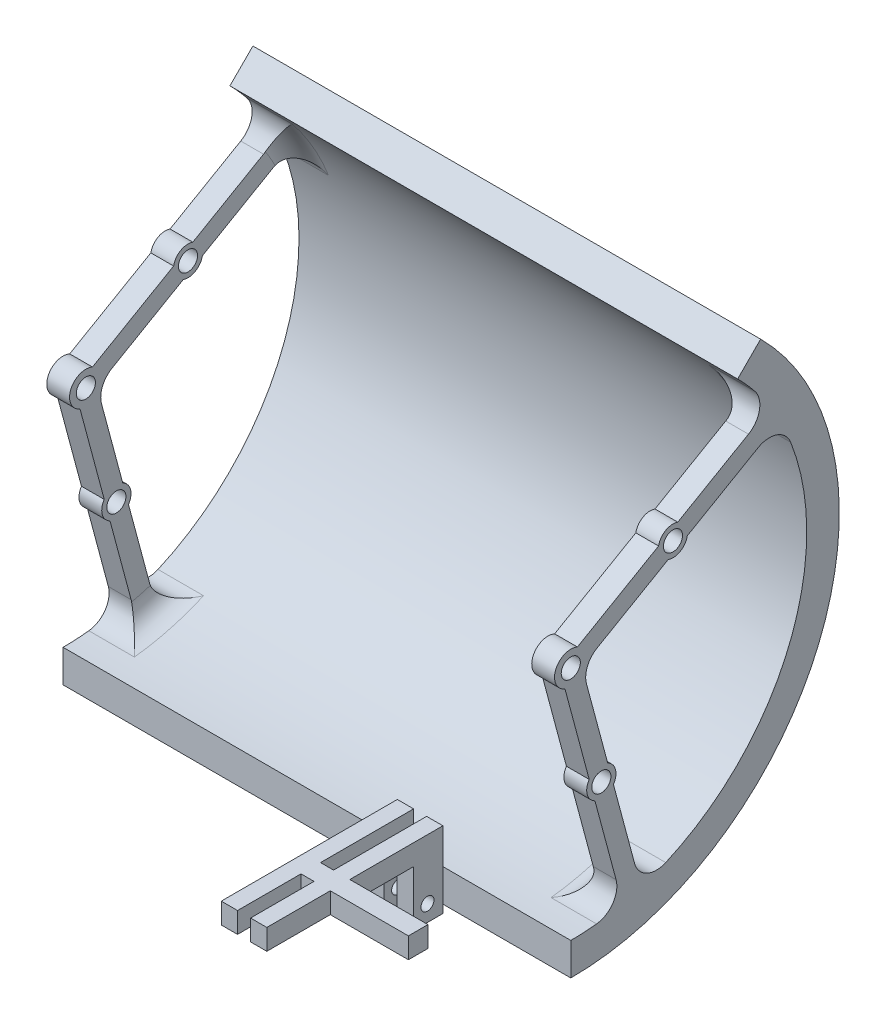
from build123d import *

# Parameters (mm, degrees)
SKETCH1_W                = 78.006
SKETCH1_H                = 5
REVOLVE1_ANGLE           = 135
BOSS_EXTRUDE1_DEPTH      = 3.5
SKETCH5_R                = 1.47
CUT_EXTRUDE1_DEPTH       = 111.505307794
FILLET1_R                = 3.5
FILLET2_R                = 3.5
SKETCH6_W                = 2.5
SKETCH6_H                = 11.68
BOSS_EXTRUDE2_DEPTH      = 4.55
SKETCH11_W               = 6.879892748
SKETCH11_H               = 4
BOSS_EXTRUDE4_DEPTH      = 79.29
SKETCH13_W               = 9.54
SKETCH13_H               = 3.842548585
BOSS_EXTRUDE5_DEPTH      = 7.5
FILLET4_R                = 4
SKETCH17_W               = 3.18
SKETCH17_H               = 7.5
CUT_EXTRUDE12_DEPTH      = 3.842548586
CUT_EXTRUDE13_REACH      = 101.676
SKETCH18_R               = 1.47
BOSS_EXTRUDE6_DEPTH      = 3.18
SKETCH21_W               = 1.284
SKETCH21_H               = 6.879892748
CUT_EXTRUDE14_DEPTH      = 108.471876866
CUT_EXTRUDE15_START      = -22.063
CUT_EXTRUDE15_DEPTH      = 22.063
CUT_EXTRUDE16_DEPTH      = 14.553
CUT_EXTRUDE17_DEPTH      = 98.779076297
CUT_EXTRUDE17_DEPTH_BACK = 98.779076297
SKETCH25_R               = 1


with BuildPart() as part:
    # Sketch1 → Revolve1 (revolve)
    with BuildSketch(Plane.XY):
        with Locations((39.003, 2.5)):
            Rectangle(SKETCH1_W, SKETCH1_H)
    revolve(axis=Axis((0, 41.25, 0), (1, 0, 0)), revolution_arc=REVOLVE1_ANGLE)

    # Sketch3 → Boss-Extrude1 (add)
    with BuildSketch(Plane(origin=(0, 0, 0), x_dir=(0, 0, -1), z_dir=(1, 0, 0))):
        with BuildLine():
            Line((7.954562011, 5.883526565), (3.71205875, 21.716764286))
            ThreePointArc((3.71205875, 21.716764286), (2.517762083, 23.160251547), (2.830309706, 25.007496518))
            Line((2.830309706, 25.007496518), (-0.896539432, 38.916286854))
            ThreePointArc((-0.896539432, 38.916286854), (-2.309698831, 42.206708581), (1.016235278, 43.534133503))
            Line((1.016235278, 43.534133503), (13.486515541, 50.73385317))
            ThreePointArc((13.486515541, 50.73385317), (14.571710444, 52.261057159), (16.436905346, 52.437261518))
            Line((16.436905346, 52.437261518), (30.632597932, 60.633148453))
            ThreePointArc((30.632597932, 60.633148453), (31.393420887, 59.375), (32.102597932, 58.087033766))
            Line((32.102597932, 58.087033766), (17.906905346, 49.89114683))
            ThreePointArc((17.906905346, 49.89114683), (16.821710444, 48.363942841), (14.956515541, 48.187738482))
            Line((14.956515541, 48.187738482), (1.711851257, 40.540927993))
            Line((1.711851257, 40.540927993), (5.670131635, 25.768424511))
            ThreePointArc((5.670131635, 25.768424511), (6.864428302, 24.32493725), (6.551880679, 22.477692279))
            Line((6.551880679, 22.477692279), (10.79438394, 6.644454558))
            ThreePointArc((10.79438394, 6.644454558), (9.382190385, 6.235188797), (7.954562011, 5.883526565))
        make_face()
    boss_extrude1 = extrude(amount=BOSS_EXTRUDE1_DEPTH)

    # Sketch5 → Cut-Extrude1 (cut, through all)
    with BuildSketch(Plane(origin=(3.5, 0, 0), x_dir=(0, 0, -1), z_dir=(1, 0, 0))):
        with Locations(Location((0, 41.25, 0), (0, 0, 90))):
            Circle(SKETCH5_R)
        with Locations(Location((4.691095192, 23.742594399, 0), (0, 0, 90))):
            Circle(SKETCH5_R)
        with Locations(Location((15.696710444, 50.3125, 0), (0, 0, 90))):
            Circle(SKETCH5_R)
    cut_extrude1 = extrude(amount=-CUT_EXTRUDE1_DEPTH, mode=Mode.SUBTRACT)

    # Mirror1: Boss-Extrude1 across plane
    add(boss_extrude1.mirror(Plane(origin=(39.003, 0, 0), x_dir=(0, 0, 1), z_dir=(1, 0, 0))))

    # Fillet1
    # the kernel refuses this fillet: 3.5 mm, written as the material it adds along each edge
    with BuildSketch(Plane(origin=(0, 5.883526565, -7.954562011), x_dir=(0, -0.16459342427635773, 0.9863614979737311), z_dir=(1, 0, 0)), Plane(origin=(0, 58.087033766, -32.102597932), x_dir=(1.0095903827657901e-15, -0.9101521320486264, -0.4142741803773673), z_dir=(1, 0, 0)), Plane(origin=(78.006, 6.644454558, -10.79438394), x_dir=(0, 0.35063866226765017, -0.9365108266983103), z_dir=(-1, 0, 0)), Plane(origin=(78.006, 60.633148453, -30.632597932), x_dir=(0, 0.8138480303630977, 0.5810777774739851), z_dir=(-1, 0, 0))) as fillet1_piece_1:
        with BuildLine():
            CenterArc((3.8544537, -3.494534817), FILLET1_R, 86.797696391, 98.728687129)
            Line((0.370721847, -3.831599173), (0, 0))
            ThreePointArc((0, 0), (2.024984733, 0.056603685), (4.049969467, 0))
        make_face()
    extrude(amount=3.5)
    with BuildSketch(Plane(origin=(0, 6.644454558, -10.79438394), x_dir=(0, 0.35063866226765, -0.9365108266983104), z_dir=(1, 0, 0)), Plane(origin=(0, 60.633148453, -30.632597932), x_dir=(0, 0.8138480303630977, 0.5810777774739851), z_dir=(1, 0, 0)), Plane(origin=(78.006, 5.883526565, -7.954562011), x_dir=(0, -0.16459342427635773, 0.9863614979737311), z_dir=(-1, 0, 0)), Plane(origin=(78.006, 58.087033766, -32.102597932), x_dir=(-1.0095903827657901e-15, -0.9101521320486264, -0.4142741803773673), z_dir=(-1, 0, 0))) as fillet1_piece_2:
        with BuildLine():
            CenterArc((3.8544537, 3.494534817), FILLET1_R, 174.47361648, 98.728687129)
            Line((0.370721847, 3.831599173), (0, 0))
            ThreePointArc((0, 0), (2.024984733, -0.056603685), (4.049969467, 0))
        make_face()
    extrude(amount=3.5)
    with BuildSketch(Plane(origin=(3.5, 41.25, 0), x_dir=(0, -0.8557788857122749, -0.517341762057788), z_dir=(0, 0.517341762057788, -0.8557788857122749))) as fillet1_piece_3_section:
        with BuildLine():
            CenterArc((36.25 - FILLET1_R, -FILLET1_R), FILLET1_R, 0, 90)
            Line((36.25 - FILLET1_R, 0), (36.25, 0))
            Line((36.25, 0), (36.25, -FILLET1_R))
        make_face()
    fillet1_piece_3 = revolve(axis=Axis((3.5, 41.25, 0), (-1, 0, 0)), revolution_arc=32.308220941, mode=Mode.PRIVATE)
    fillet1_piece_3 = split(fillet1_piece_3, bisect_by=Plane(origin=(3.5, 40.869536004, 1.419910965), z_dir=(0, 0.2588190451025147, -0.9659258262890699)), keep=Keep.TOP, mode=Mode.PRIVATE)
    fillet1_piece_3 = split(fillet1_piece_3, bisect_by=Plane(origin=(3.5, 41.630463996, -1.419910965), z_dir=(0, -0.2588190451025142, 0.9659258262890701)), keep=Keep.TOP, mode=Mode.PRIVATE)
    add(fillet1_piece_3)
    with BuildSketch(Plane(origin=(3.5, 41.25, 0), x_dir=(0, 0.7212056430084437, -0.6927210264549339), z_dir=(0, 0.6927210264549339, 0.7212056430084437))) as fillet1_piece_4_section:
        with BuildLine():
            CenterArc((36.25 - FILLET1_R, -FILLET1_R), FILLET1_R, 360, 90)
            Line((36.25 - FILLET1_R, 0), (36.25, 0))
            Line((36.25, 0), (36.25, -FILLET1_R))
        make_face()
    fillet1_piece_4 = revolve(axis=Axis((3.5, 41.25, 0), (-1, 0, 0)), revolution_arc=32.308220941, mode=Mode.PRIVATE)
    fillet1_piece_4 = split(fillet1_piece_4, bisect_by=Plane(origin=(3.5, 42.523057344, 0.735), z_dir=(0, -0.8660254037844376, -0.5000000000000018)), keep=Keep.TOP, mode=Mode.PRIVATE)
    fillet1_piece_4 = split(fillet1_piece_4, bisect_by=Plane(origin=(3.5, 39.976942656, -0.735), z_dir=(0, 0.8660254037844395, 0.4999999999999985)), keep=Keep.TOP, mode=Mode.PRIVATE)
    add(fillet1_piece_4)
    with BuildSketch(Plane(origin=(74.506, 41.25, 0), x_dir=(-1.1760707350509122e-15, -0.8557788857122749, -0.517341762057788), z_dir=(0, 0.517341762057788, -0.8557788857122749))) as fillet1_piece_5_section:
        with BuildLine():
            CenterArc((36.25 - FILLET1_R, FILLET1_R), FILLET1_R, 270, 90)
            Line((36.25 - FILLET1_R, 0), (36.25, 0))
            Line((36.25, 0), (36.25, FILLET1_R))
        make_face()
    fillet1_piece_5 = revolve(axis=Axis((74.506, 41.25, 0), (-1, 0, 0)), revolution_arc=32.308220941, mode=Mode.PRIVATE)
    fillet1_piece_5 = split(fillet1_piece_5, bisect_by=Plane(origin=(74.506, 40.869536004, 1.419910965), z_dir=(0, 0.2588190451025147, -0.9659258262890699)), keep=Keep.TOP, mode=Mode.PRIVATE)
    fillet1_piece_5 = split(fillet1_piece_5, bisect_by=Plane(origin=(74.506, 41.630463996, -1.419910965), z_dir=(0, -0.2588190451025142, 0.9659258262890701)), keep=Keep.TOP, mode=Mode.PRIVATE)
    add(fillet1_piece_5)
    with BuildSketch(Plane(origin=(74.506, 41.25, 0), x_dir=(0, 0.7212056430084435, -0.6927210264549343), z_dir=(0, 0.6927210264549343, 0.7212056430084435))) as fillet1_piece_6_section:
        with BuildLine():
            CenterArc((36.25 - FILLET1_R, FILLET1_R), FILLET1_R, 270, 90)
            Line((36.25 - FILLET1_R, 0), (36.25, 0))
            Line((36.25, 0), (36.25, FILLET1_R))
        make_face()
    fillet1_piece_6 = revolve(axis=Axis((74.506, 41.25, 0), (-1, 0, 0)), revolution_arc=32.308220941, mode=Mode.PRIVATE)
    fillet1_piece_6 = split(fillet1_piece_6, bisect_by=Plane(origin=(74.506, 42.523057344, 0.735), z_dir=(0, -0.8660254037844376, -0.5000000000000018)), keep=Keep.TOP, mode=Mode.PRIVATE)
    fillet1_piece_6 = split(fillet1_piece_6, bisect_by=Plane(origin=(74.506, 39.976942656, -0.735), z_dir=(0, 0.8660254037844395, 0.4999999999999985)), keep=Keep.TOP, mode=Mode.PRIVATE)
    add(fillet1_piece_6)
    with BuildSketch(Plane(origin=(0, 5.883526565, -7.954562011), x_dir=(0, -0.16459342427635773, 0.9863614979737311), z_dir=(1, 0, 0))) as fillet1_piece_7a_section:
        with BuildLine():
            CenterArc((3.8544537, -3.494534817), FILLET1_R, 86.797696391, 98.728687129)
            Line((0.370721847, -3.831599173), (0, 0))
            ThreePointArc((0, 0), (2.024984733, 0.056603685), (4.049969467, 0))
        make_face()
    fillet1_piece_7a = extrude(amount=13.624923667, mode=Mode.PRIVATE)
    fillet1_piece_7a = split(fillet1_piece_7a, bisect_by=Plane(origin=(3.5, 5.883526565, -7.954562011), z_dir=(1, 0, 0)), keep=Keep.TOP, mode=Mode.PRIVATE)
    with BuildSketch(Plane(origin=(3.5, 41.25, 0), x_dir=(0, -0.8557788857122749, -0.517341762057788), z_dir=(0, 0.517341762057788, -0.8557788857122749))) as fillet1_piece_7b_section:
        with BuildLine():
            CenterArc((36.25 - FILLET1_R, -FILLET1_R), FILLET1_R, 0, 90)
            Line((36.25 - FILLET1_R, 0), (36.25, 0))
            Line((36.25, 0), (36.25, -FILLET1_R))
        make_face()
    fillet1_piece_7b = revolve(axis=Axis((3.5, 41.25, 0), (-1, 0, 0)), revolution_arc=32.308220941, mode=Mode.PRIVATE)
    fillet1_piece_7b = split(fillet1_piece_7b, bisect_by=Plane(origin=(3.5, 41.25, 0), z_dir=(0, 0, -1)), keep=Keep.TOP, mode=Mode.PRIVATE)
    fillet1_piece_7b = split(fillet1_piece_7b, bisect_by=Plane(origin=(3.5, 40.869536004, 1.419910965), z_dir=(0, -0.2588190451025147, 0.9659258262890699)), keep=Keep.TOP, mode=Mode.PRIVATE)
    fillet1_piece_7 = fillet1_piece_7a & fillet1_piece_7b
    add(fillet1_piece_7)
    with BuildSketch(Plane(origin=(3.5, 41.25, 0), x_dir=(0, -0.8557788857122749, -0.517341762057788), z_dir=(0, 0.517341762057788, -0.8557788857122749))) as fillet1_piece_8a_section:
        with BuildLine():
            CenterArc((36.25 - FILLET1_R, -FILLET1_R), FILLET1_R, 0, 90)
            Line((36.25 - FILLET1_R, 0), (36.25, 0))
            Line((36.25, 0), (36.25, -FILLET1_R))
        make_face()
    fillet1_piece_8a = revolve(axis=Axis((3.5, 41.25, 0), (-1, 0, 0)), revolution_arc=32.308220941, mode=Mode.PRIVATE)
    fillet1_piece_8a = split(fillet1_piece_8a, bisect_by=Plane(origin=(3.5, 41.630463996, -1.419910965), z_dir=(0, 0.2588190451025142, -0.9659258262890701)), keep=Keep.TOP, mode=Mode.PRIVATE)
    with BuildSketch(Plane(origin=(0, 6.644454558, -10.79438394), x_dir=(0, 0.35063866226765, -0.9365108266983104), z_dir=(1, 0, 0))) as fillet1_piece_8b_section:
        with BuildLine():
            CenterArc((3.8544537, 3.494534817), FILLET1_R, 174.47361648, 98.728687129)
            Line((0.370721847, 3.831599173), (0, 0))
            ThreePointArc((0, 0), (2.024984733, -0.056603685), (4.049969467, 0))
        make_face()
    fillet1_piece_8b = extrude(amount=13.624923667, mode=Mode.PRIVATE)
    fillet1_piece_8b = split(fillet1_piece_8b, bisect_by=Plane(origin=(3.5, 6.644454558, -10.79438394), z_dir=(1, 0, 0)), keep=Keep.TOP, mode=Mode.PRIVATE)
    fillet1_piece_8 = fillet1_piece_8a & fillet1_piece_8b
    add(fillet1_piece_8)
    with BuildSketch(Plane(origin=(0, 58.087033766, -32.102597932), x_dir=(1.0095903827657901e-15, -0.9101521320486264, -0.4142741803773673), z_dir=(1, 0, 0))) as fillet1_piece_9a_section:
        with BuildLine():
            CenterArc((3.8544537, -3.494534817), FILLET1_R, 86.797696391, 98.728687129)
            Line((0.370721847, -3.831599173), (0, 0))
            ThreePointArc((0, 0), (2.024984733, 0.056603685), (4.049969467, 0))
        make_face()
    fillet1_piece_9a = extrude(amount=13.624923667, mode=Mode.PRIVATE)
    fillet1_piece_9a = split(fillet1_piece_9a, bisect_by=Plane(origin=(3.5, 58.087033766, -32.102597932), z_dir=(1, 0, 0)), keep=Keep.TOP, mode=Mode.PRIVATE)
    with BuildSketch(Plane(origin=(3.5, 41.25, 0), x_dir=(0, 0.7212056430084437, -0.6927210264549339), z_dir=(0, 0.6927210264549339, 0.7212056430084437))) as fillet1_piece_9b_section:
        with BuildLine():
            CenterArc((36.25 - FILLET1_R, -FILLET1_R), FILLET1_R, 360, 90)
            Line((36.25 - FILLET1_R, 0), (36.25, 0))
            Line((36.25, 0), (36.25, -FILLET1_R))
        make_face()
    fillet1_piece_9b = revolve(axis=Axis((3.5, 41.25, 0), (-1, 0, 0)), revolution_arc=32.308220941, mode=Mode.PRIVATE)
    fillet1_piece_9b = split(fillet1_piece_9b, bisect_by=Plane(origin=(3.5, 39.976942656, -0.735), z_dir=(0, -0.8660254037844395, -0.4999999999999985)), keep=Keep.TOP, mode=Mode.PRIVATE)
    fillet1_piece_9 = fillet1_piece_9a & fillet1_piece_9b
    add(fillet1_piece_9)
    with BuildSketch(Plane(origin=(3.5, 41.25, 0), x_dir=(0, 0.7212056430084437, -0.6927210264549339), z_dir=(0, 0.6927210264549339, 0.7212056430084437))) as fillet1_piece_10a_section:
        with BuildLine():
            CenterArc((36.25 - FILLET1_R, -FILLET1_R), FILLET1_R, 360, 90)
            Line((36.25 - FILLET1_R, 0), (36.25, 0))
            Line((36.25, 0), (36.25, -FILLET1_R))
        make_face()
    fillet1_piece_10a = revolve(axis=Axis((3.5, 41.25, 0), (-1, 0, 0)), revolution_arc=32.308220941, mode=Mode.PRIVATE)
    fillet1_piece_10a = split(fillet1_piece_10a, bisect_by=Plane(origin=(3.5, 41.25, 0), z_dir=(0, -0.7071067811865438, -0.7071067811865512)), keep=Keep.TOP, mode=Mode.PRIVATE)
    fillet1_piece_10a = split(fillet1_piece_10a, bisect_by=Plane(origin=(3.5, 42.523057344, 0.735), z_dir=(0, 0.8660254037844376, 0.5000000000000018)), keep=Keep.TOP, mode=Mode.PRIVATE)
    with BuildSketch(Plane(origin=(0, 60.633148453, -30.632597932), x_dir=(0, 0.8138480303630977, 0.5810777774739851), z_dir=(1, 0, 0))) as fillet1_piece_10b_section:
        with BuildLine():
            CenterArc((3.8544537, 3.494534817), FILLET1_R, 174.47361648, 98.728687129)
            Line((0.370721847, 3.831599173), (0, 0))
            ThreePointArc((0, 0), (2.024984733, -0.056603685), (4.049969467, 0))
        make_face()
    fillet1_piece_10b = extrude(amount=13.624923667, mode=Mode.PRIVATE)
    fillet1_piece_10b = split(fillet1_piece_10b, bisect_by=Plane(origin=(3.5, 60.633148453, -30.632597932), z_dir=(1, 0, 0)), keep=Keep.TOP, mode=Mode.PRIVATE)
    fillet1_piece_10 = fillet1_piece_10a & fillet1_piece_10b
    add(fillet1_piece_10)
    with BuildSketch(Plane(origin=(78.006, 6.644454558, -10.79438394), x_dir=(0, 0.35063866226765017, -0.9365108266983103), z_dir=(-1, 0, 0))) as fillet1_piece_11a_section:
        with BuildLine():
            CenterArc((3.8544537, -3.494534817), FILLET1_R, 86.797696391, 98.728687129)
            Line((0.370721847, -3.831599173), (0, 0))
            ThreePointArc((0, 0), (2.024984733, 0.056603685), (4.049969467, 0))
        make_face()
    fillet1_piece_11a = extrude(amount=13.624923667, mode=Mode.PRIVATE)
    fillet1_piece_11a = split(fillet1_piece_11a, bisect_by=Plane(origin=(74.506, 6.644454558, -10.79438394), z_dir=(-1, 0, 0)), keep=Keep.TOP, mode=Mode.PRIVATE)
    with BuildSketch(Plane(origin=(74.506, 41.25, 0), x_dir=(-1.1760707350509122e-15, -0.8557788857122749, -0.517341762057788), z_dir=(0, 0.517341762057788, -0.8557788857122749))) as fillet1_piece_11b_section:
        with BuildLine():
            CenterArc((36.25 - FILLET1_R, FILLET1_R), FILLET1_R, 270, 90)
            Line((36.25 - FILLET1_R, 0), (36.25, 0))
            Line((36.25, 0), (36.25, FILLET1_R))
        make_face()
    fillet1_piece_11b = revolve(axis=Axis((74.506, 41.25, 0), (-1, 0, 0)), revolution_arc=32.308220941, mode=Mode.PRIVATE)
    fillet1_piece_11b = split(fillet1_piece_11b, bisect_by=Plane(origin=(74.506, 41.630463996, -1.419910965), z_dir=(0, 0.2588190451025142, -0.9659258262890701)), keep=Keep.TOP, mode=Mode.PRIVATE)
    fillet1_piece_11 = fillet1_piece_11a & fillet1_piece_11b
    add(fillet1_piece_11)
    with BuildSketch(Plane(origin=(74.506, 41.25, 0), x_dir=(-1.1760707350509122e-15, -0.8557788857122749, -0.517341762057788), z_dir=(0, 0.517341762057788, -0.8557788857122749))) as fillet1_piece_12a_section:
        with BuildLine():
            CenterArc((36.25 - FILLET1_R, FILLET1_R), FILLET1_R, 270, 90)
            Line((36.25 - FILLET1_R, 0), (36.25, 0))
            Line((36.25, 0), (36.25, FILLET1_R))
        make_face()
    fillet1_piece_12a = revolve(axis=Axis((74.506, 41.25, 0), (-1, 0, 0)), revolution_arc=32.308220941, mode=Mode.PRIVATE)
    fillet1_piece_12a = split(fillet1_piece_12a, bisect_by=Plane(origin=(74.506, 41.25, 0), z_dir=(0, 0, -1)), keep=Keep.TOP, mode=Mode.PRIVATE)
    fillet1_piece_12a = split(fillet1_piece_12a, bisect_by=Plane(origin=(74.506, 40.869536004, 1.419910965), z_dir=(0, -0.2588190451025147, 0.9659258262890699)), keep=Keep.TOP, mode=Mode.PRIVATE)
    with BuildSketch(Plane(origin=(78.006, 5.883526565, -7.954562011), x_dir=(0, -0.16459342427635773, 0.9863614979737311), z_dir=(-1, 0, 0))) as fillet1_piece_12b_section:
        with BuildLine():
            CenterArc((3.8544537, 3.494534817), FILLET1_R, 174.47361648, 98.728687129)
            Line((0.370721847, 3.831599173), (0, 0))
            ThreePointArc((0, 0), (2.024984733, -0.056603685), (4.049969467, 0))
        make_face()
    fillet1_piece_12b = extrude(amount=13.624923667, mode=Mode.PRIVATE)
    fillet1_piece_12b = split(fillet1_piece_12b, bisect_by=Plane(origin=(74.506, 5.883526565, -7.954562011), z_dir=(-1, 0, 0)), keep=Keep.TOP, mode=Mode.PRIVATE)
    fillet1_piece_12 = fillet1_piece_12a & fillet1_piece_12b
    add(fillet1_piece_12)
    with BuildSketch(Plane(origin=(78.006, 60.633148453, -30.632597932), x_dir=(0, 0.8138480303630977, 0.5810777774739851), z_dir=(-1, 0, 0))) as fillet1_piece_13a_section:
        with BuildLine():
            CenterArc((3.8544537, -3.494534817), FILLET1_R, 86.797696391, 98.728687129)
            Line((0.370721847, -3.831599173), (0, 0))
            ThreePointArc((0, 0), (2.024984733, 0.056603685), (4.049969467, 0))
        make_face()
    fillet1_piece_13a = extrude(amount=13.624923667, mode=Mode.PRIVATE)
    fillet1_piece_13a = split(fillet1_piece_13a, bisect_by=Plane(origin=(74.506, 60.633148453, -30.632597932), z_dir=(-1, 0, 0)), keep=Keep.TOP, mode=Mode.PRIVATE)
    with BuildSketch(Plane(origin=(74.506, 41.25, 0), x_dir=(0, 0.7212056430084435, -0.6927210264549343), z_dir=(0, 0.6927210264549343, 0.7212056430084435))) as fillet1_piece_13b_section:
        with BuildLine():
            CenterArc((36.25 - FILLET1_R, FILLET1_R), FILLET1_R, 270, 90)
            Line((36.25 - FILLET1_R, 0), (36.25, 0))
            Line((36.25, 0), (36.25, FILLET1_R))
        make_face()
    fillet1_piece_13b = revolve(axis=Axis((74.506, 41.25, 0), (-1, 0, 0)), revolution_arc=32.308220941, mode=Mode.PRIVATE)
    fillet1_piece_13b = split(fillet1_piece_13b, bisect_by=Plane(origin=(74.506, 41.25, 0), z_dir=(0, -0.7071067811865438, -0.7071067811865512)), keep=Keep.TOP, mode=Mode.PRIVATE)
    fillet1_piece_13b = split(fillet1_piece_13b, bisect_by=Plane(origin=(74.506, 42.523057344, 0.735), z_dir=(0, 0.8660254037844376, 0.5000000000000018)), keep=Keep.TOP, mode=Mode.PRIVATE)
    fillet1_piece_13 = fillet1_piece_13a & fillet1_piece_13b
    add(fillet1_piece_13)
    with BuildSketch(Plane(origin=(74.506, 41.25, 0), x_dir=(0, 0.7212056430084435, -0.6927210264549343), z_dir=(0, 0.6927210264549343, 0.7212056430084435))) as fillet1_piece_14a_section:
        with BuildLine():
            CenterArc((36.25 - FILLET1_R, FILLET1_R), FILLET1_R, 270, 90)
            Line((36.25 - FILLET1_R, 0), (36.25, 0))
            Line((36.25, 0), (36.25, FILLET1_R))
        make_face()
    fillet1_piece_14a = revolve(axis=Axis((74.506, 41.25, 0), (-1, 0, 0)), revolution_arc=32.308220941, mode=Mode.PRIVATE)
    fillet1_piece_14a = split(fillet1_piece_14a, bisect_by=Plane(origin=(74.506, 39.976942656, -0.735), z_dir=(0, -0.8660254037844395, -0.4999999999999985)), keep=Keep.TOP, mode=Mode.PRIVATE)
    with BuildSketch(Plane(origin=(78.006, 58.087033766, -32.102597932), x_dir=(-1.0095903827657901e-15, -0.9101521320486264, -0.4142741803773673), z_dir=(-1, 0, 0))) as fillet1_piece_14b_section:
        with BuildLine():
            CenterArc((3.8544537, 3.494534817), FILLET1_R, 174.47361648, 98.728687129)
            Line((0.370721847, 3.831599173), (0, 0))
            ThreePointArc((0, 0), (2.024984733, -0.056603685), (4.049969467, 0))
        make_face()
    fillet1_piece_14b = extrude(amount=13.624923667, mode=Mode.PRIVATE)
    fillet1_piece_14b = split(fillet1_piece_14b, bisect_by=Plane(origin=(74.506, 58.087033766, -32.102597932), z_dir=(-1, 0, 0)), keep=Keep.TOP, mode=Mode.PRIVATE)
    fillet1_piece_14 = fillet1_piece_14a & fillet1_piece_14b
    add(fillet1_piece_14)

    # Fillet2
    fillet2_edges = [part.edges().sort_by_distance(p)[0] for p in [
        (1.75, 40.540927993, -1.711851257),
        (76.256, 40.540927993, -1.711851257),
    ]]
    fillet(fillet2_edges, radius=FILLET2_R)

    # Mirror2: Cut-Extrude1 across plane
    add(cut_extrude1.mirror(Plane(origin=(39.003, 0, 0), x_dir=(0, 0, 1), z_dir=(1, 0, 0))), mode=Mode.SUBTRACT)

    # Sketch6 → Boss-Extrude2 (add)
    with BuildSketch(Plane.XY):
        with Locations((52.606, 4.59)):
            Rectangle(SKETCH6_W, SKETCH6_H)
        with Locations((57.106, 4.59)):
            Rectangle(SKETCH6_W, SKETCH6_H)
    extrude(amount=BOSS_EXTRUDE2_DEPTH)

    # Sketch11 → Boss-Extrude4 (add)
    with BuildSketch(Plane.ZY):
        with Locations((-28.161776221, 12.737858838)):
            Rectangle(SKETCH11_W, SKETCH11_H)
    extrude(amount=-BOSS_EXTRUDE4_DEPTH)

    # Sketch13 → Boss-Extrude5 (add)
    with BuildSketch(Plane.XZ.offset(-10.737858838)):
        with Locations((26.833, -29.680448303)):
            Rectangle(SKETCH13_W, SKETCH13_H)
        with Locations((58.683, -29.680448303)):
            Rectangle(SKETCH13_W, SKETCH13_H)
    extrude(amount=BOSS_EXTRUDE5_DEPTH)

    # Fillet4
    # the kernel refuses this fillet: 4 mm, written as the material it takes off along each edge
    with BuildSketch(Plane(origin=(31.603, 10.737858838, -31.601722595), x_dir=(0, 1, 0), z_dir=(1, 0, 0))) as fillet4_piece_1:
        with BuildLine():
            CenterArc((3.99689993, 4), FILLET4_R, 182.255908198, 87.744091802)
            Line((0, 3.842548586), (0, 0))
            Line((0, 0), (3.99689993, 0))
        make_face()
    extrude(amount=22.31, mode=Mode.SUBTRACT)

    # Sketch17 → Cut-Extrude12 (cut)
    with BuildSketch(Plane(origin=(0, 0, -31.601722595), x_dir=(-1, 0, 0), z_dir=(0, 0, -1))):
        with Locations((-26.833, 6.987858838)):
            Rectangle(SKETCH17_W, SKETCH17_H)
        with Locations((-58.683, 6.987858838)):
            Rectangle(SKETCH17_W, SKETCH17_H)
    extrude(amount=-CUT_EXTRUDE12_DEPTH, mode=Mode.SUBTRACT)

    # Cut-Extrude13: up to this face of the body (flat: up to its plane)
    cut_extrude13_end = Plane(part.part.faces().sort_by_distance((63.453, 6.987858838, -29.680448302))[0])
    # Sketch18 → Cut-Extrude13 (cut, up to the picked face)
    with BuildSketch(Plane.ZY.offset(-22.063), mode=Mode.PRIVATE) as cut_extrude13_sk1:
        with Locations((-29.67917401, 6.237858838)):
            Circle(SKETCH18_R)
    cut_extrude13_tool1 = split(extrude(cut_extrude13_sk1.sketch, amount=-CUT_EXTRUDE13_REACH, mode=Mode.PRIVATE), bisect_by=cut_extrude13_end, keep=Keep.BOTH, mode=Mode.PRIVATE)
    add(cut_extrude13_tool1.solids().sort_by(Axis((22.063, 6.237859, -29.679174), (1, 0, 0)))[0], mode=Mode.SUBTRACT)

    # Sketch20 → Boss-Extrude6 (add)
    with BuildSketch(Plane(origin=(0, 10.43, 0), x_dir=(1, 0, 0), z_dir=(0, 1, 0))):
        Polygon((58.356, -4.55), (55.856, -4.55), (55.856, -14.3), (53.856, -14.3), (53.856, -4.55), (51.356, -4.55), (51.356, -27.05), (53.856, -27.05), (53.856, -17.3), (55.856, -17.3), (55.856, -27.05), (58.356, -27.05), (58.356, -17.3), (70.356, -17.3), (70.356, -14.3), (58.356, -14.3), align=None)
    extrude(amount=-BOSS_EXTRUDE6_DEPTH)

    # Sketch21 → Cut-Extrude14 (cut, through all)
    with BuildSketch(Plane.XZ.offset(-10.737858838)):
        with Locations((78.648, -28.161776221)):
            Rectangle(SKETCH21_W, SKETCH21_H)
    extrude(amount=-CUT_EXTRUDE14_DEPTH, mode=Mode.SUBTRACT)

    # Sketch14 → Cut-Extrude15 (cut)
    with BuildSketch(Plane.ZY.offset(CUT_EXTRUDE15_START)):
        with BuildLine():
            Line((-27.75917401, 10.737858838), (-32.658153495, 9.737858838))
            Line((-32.658153495, 9.737858838), (-31.601722595, 14.737858838))
            ThreePointArc((-31.601722595, 14.737858838), (-29.74775641, 12.673200169), (-27.75917401, 10.737858838))
        make_face()
    extrude(amount=CUT_EXTRUDE15_DEPTH, mode=Mode.SUBTRACT)

    # Sketch23 → Cut-Extrude16 (cut)
    with BuildSketch(Plane(origin=(78.006, 0, 0), x_dir=(0, 0, -1), z_dir=(1, 0, 0))):
        with BuildLine():
            Line((27.75917401, 10.737858838), (34.508875427, 8.099492383))
            Line((34.508875427, 8.099492383), (31.601722595, 14.737858838))
            ThreePointArc((31.601722595, 14.737858838), (29.74775641, 12.673200169), (27.75917401, 10.737858838))
        make_face()
    extrude(amount=-CUT_EXTRUDE16_DEPTH, mode=Mode.SUBTRACT)

    # Sketch25 → Cut-Extrude17 (cut, two sides: drawn at the far end of the back side and taken through both)
    with BuildSketch(Plane(origin=(53.856, 0, 0), x_dir=(0, 0, -1), z_dir=(1, 0, 0)).offset(-CUT_EXTRUDE17_DEPTH_BACK)):
        with Locations((-2.375, 1.25)):
            Circle(SKETCH25_R)
    extrude(amount=CUT_EXTRUDE17_DEPTH + CUT_EXTRUDE17_DEPTH_BACK, mode=Mode.SUBTRACT)


solid = part.part
